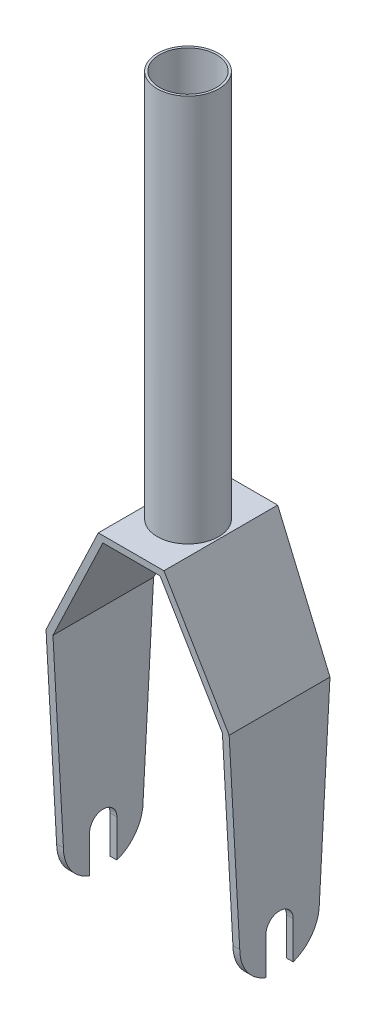
from build123d import *

# Parameters (mm, degrees)
SKETCH1_R           = 13.5
SKETCH1_R_2         = 12.5
BOSS_EXTRUDE1_DEPTH = 175
SKETCH3_W           = 50
SKETCH3_H           = 3
CUT_EXTRUDE1_START  = -150
SKETCH4_OUTSIDE_W   = 118.052
SKETCH4_OUTSIDE_H   = 390.052
CUT_EXTRUDE1_DEPTH  = 335.767590502
CUT_EXTRUDE2_REACH  = 181.854
SKETCH5_R           = 12.5


with BuildPart() as part:
    # Sketch1 → Boss-Extrude1 (new body)
    with BuildSketch(Plane(origin=(0, 0, 0), x_dir=(1, 0, 0), z_dir=(0, 1, 0))):
        Circle(SKETCH1_R)
        Circle(SKETCH1_R_2, mode=Mode.SUBTRACT)
    extrude(amount=BOSS_EXTRUDE1_DEPTH)

    # Sweep1: sweep along a path in Sketch2
    with BuildLine(Plane.XY) as sweep1_path:
        Line((38.75, -147), (38.75, -47))
        Line((38.75, -47), (13.5, 3))
        Line((13.5, 3), (0, 3))
    # Sketch3 → Sweep1 (sweep)
    with BuildSketch(Plane(origin=(0, 0, 0), x_dir=(0, 0, -1), z_dir=(1, 0, 0))):
        with Locations((0, 3)):
            Rectangle(SKETCH3_W, SKETCH3_H)
    sweep1 = sweep(path=sweep1_path.line, transition=Transition.RIGHT)

    # Sketch4 outside → Cut-Extrude1 (cut)
    with BuildSketch(Plane(origin=(40.25, 0, 0), x_dir=(0, 0, -1), z_dir=(1, 0, 0)).offset(CUT_EXTRUDE1_START)):
        with Locations((0, 14)):
            Rectangle(SKETCH4_OUTSIDE_W, SKETCH4_OUTSIDE_H)
        with BuildLine():
            Line((-6, -147), (-6, -130.560717777))
            ThreePointArc((-6, -130.560717777), (0, -124.560717777), (6, -130.560717777))
            Line((6, -130.560717777), (6, -147))
            ThreePointArc((6, -147), (14.3396304, -140.591919101), (17.5, -130.560717777))
            Line((17.5, -130.560717777), (25, 4.5))
            Line((25, 4.5), (25, 175))
            Line((25, 175), (-25, 175))
            Line((-25, 175), (-25, 4.5))
            Line((-25, 4.5), (-17.5, -130.560717777))
            ThreePointArc((-17.5, -130.560717777), (-14.3396304, -140.591919101), (-6, -147))
        make_face(mode=Mode.SUBTRACT)
    cut_extrude1 = extrude(amount=CUT_EXTRUDE1_DEPTH, mode=Mode.SUBTRACT)

    # Mirror1: Sweep1, Cut-Extrude1 across plane
    add(sweep1.mirror(Plane(origin=(0, 0, 0), x_dir=(0, 0, 1), z_dir=(1, 0, 0))))
    add(cut_extrude1.mirror(Plane(origin=(0, 0, 0), x_dir=(0, 0, 1), z_dir=(1, 0, 0))), mode=Mode.SUBTRACT)

    # Sketch5 → Cut-Extrude2 (cut, up to next)
    with BuildSketch(Plane.XZ.offset(-1.5), mode=Mode.PRIVATE) as cut_extrude2_sk1:
        Circle(SKETCH5_R)
    cut_extrude2_tool1 = extrude(cut_extrude2_sk1.sketch, amount=-CUT_EXTRUDE2_REACH, mode=Mode.PRIVATE) & part.part
    add(cut_extrude2_tool1.solids().sort_by_distance((0, 1.5, 0))[0], mode=Mode.SUBTRACT)


solid = part.part
